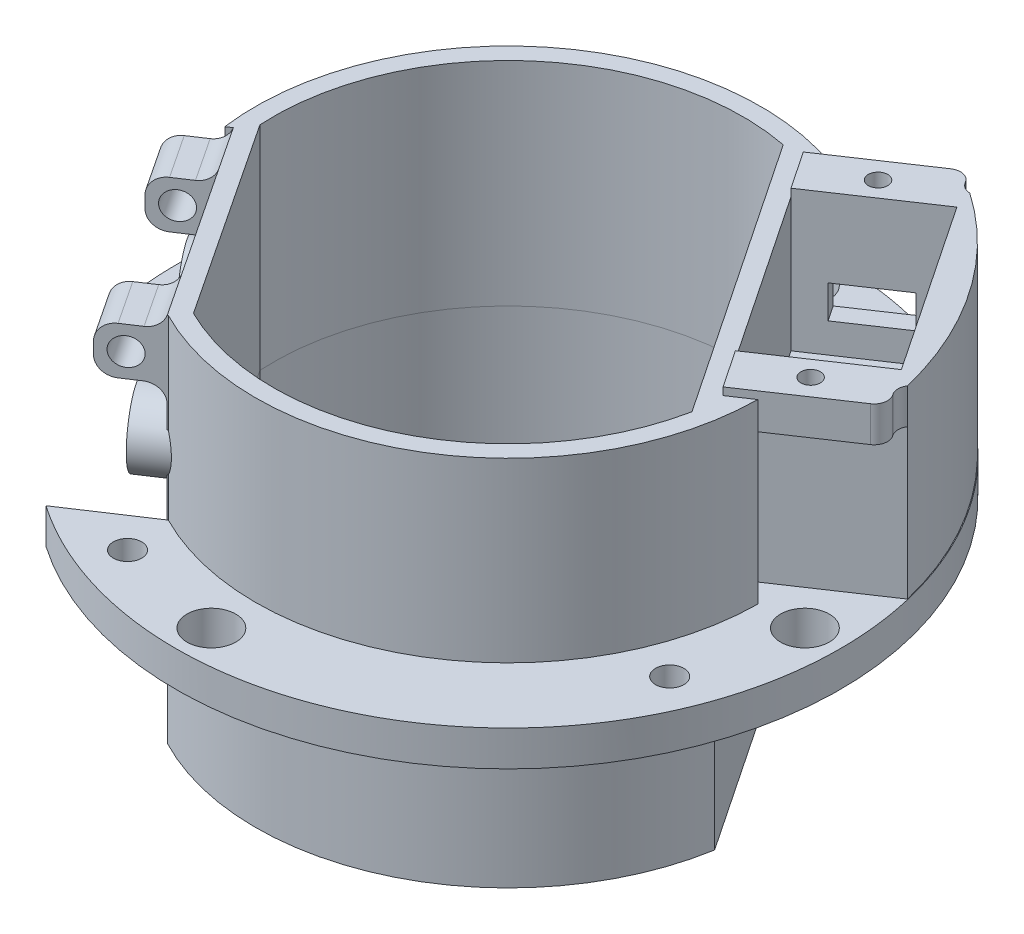
from build123d import *

# Parameters (mm, degrees)
SKETCH1_R           = 37.5
BOSS_EXTRUDE1_DEPTH = 4
BOSS_EXTRUDE2_DEPTH = 20
SKETCH5_R           = 2.75
SKETCH5_R_2         = 1.6
CUT_EXTRUDE2_DEPTH  = 10
BOSS_EXTRUDE3_DEPTH = 13.5
BOSS_EXTRUDE4_DEPTH = 20.85
FILLET2_R           = 1.5
FILLET3_R           = 1.5
SKETCH9_R           = 1.099999999
SKETCH9_R_2         = 1.1
CUT_EXTRUDE3_DEPTH  = 3.5
SKETCH10_W          = 7.15661295
SKETCH10_H          = 3.712399304
CUT_EXTRUDE4_DEPTH  = 2.5
CUT_EXTRUDE5_DEPTH  = 5.5
BOSS_EXTRUDE5_START = -0.8
SKETCH12_R          = 4
BOSS_EXTRUDE5_DEPTH = 4
SKETCH13_R          = 2.1
CUT_EXTRUDE6_DEPTH  = 4
CUT_EXTRUDE7_START  = -10
CUT_EXTRUDE7_DEPTH  = 10
BOSS_EXTRUDE6_DEPTH = 18
SHELL1_T            = -2
SKETCH17_W          = 5.885203378
SKETCH17_H          = 5.337100414
BOSS_EXTRUDE7_DEPTH = 6
SKETCH18_R          = 1.55
CUT_EXTRUDE8_DEPTH  = 47
FILLET4_R           = 2


# Some blends are built 0.0001 mm under size
with BuildPart() as part:
    # Sketch1 → Boss-Extrude1 (new body)
    with BuildSketch(Plane(origin=(0, 0, 0), x_dir=(1, 0, 0), z_dir=(0, 1, 0))):
        with Locations(Location((0, 0, 0), (0, 0, 270))):
            Circle(SKETCH1_R)
    extrude(amount=BOSS_EXTRUDE1_DEPTH)

    # Sketch3 → Boss-Extrude2 (add)
    with BuildSketch(Plane(origin=(0, 4, 0), x_dir=(1, 0, 0), z_dir=(0, 1, 0))):
        with BuildLine():
            Line((9.576757292, 26.842796422), (7.719584901, 25.597712426))
            Line((7.719584901, 25.597712426), (26.151524, -1.895443469))
            Line((26.151524, -1.895443469), (28.498178651, -0.322201176))
            ThreePointArc((28.498178651, -0.322201176), (14.731875513, -24.397168768), (-12.983961499, -25.370588164))
            Line((-12.983961499, -25.370588164), (-13.060506914, -25.421249846))
            Line((-13.060506914, -25.421249846), (-15.809741222, -21.267394822))
            Line((-15.809741222, -21.267394822), (-25.75450861, -6.241712264))
            Line((-25.75450861, -6.241712264), (-27.675272058, -3.339604984))
            Line((-27.675272058, -3.339604984), (-28.255683957, -3.723751348))
            ThreePointArc((-28.255683957, -3.723751348), (-17.91100321, 22.168580559), (9.576757292, 26.842796422))
        make_face()
        with BuildLine():
            Line((5.029746617, 26.018294505), (25.978878936, -5.229517112))
            ThreePointArc((25.978878936, -5.229517112), (11.666379673, -23.793814014), (-11.774565453, -23.740463525))
            Line((-11.774565453, -23.740463525), (-26.453975583, -1.561145685))
            ThreePointArc((-26.453975583, -1.561145685), (-17.461551391, 19.933495002), (5.029746617, 26.018294505))
        make_face(mode=Mode.SUBTRACT)
    extrude(amount=BOSS_EXTRUDE2_DEPTH)

    # Sketch5 → Cut-Extrude2 (cut)
    with BuildSketch(Plane(origin=(0, 4, 0), x_dir=(1, 0, 0), z_dir=(0, 1, 0))):
        with Locations(Location((-33.494924463, 0.000134114, 0), (0, 0, 270))):
            Circle(SKETCH5_R)
        with Locations(Location((-0.000133567, 33.494790806, 0), (0, 0, 270))):
            Circle(SKETCH5_R)
        with Locations(Location((33.494523125, -9e-08, 0), (0, 0, 270))):
            Circle(SKETCH5_R)
        with Locations(Location((-0.000267771, -33.494656782, 0), (0, 0, 270))):
            Circle(SKETCH5_R)
        with Locations(Location((-12.362017583, -30.597067201, 0), (0, 0, 270))):
            Circle(SKETCH5_R_2)
        with Locations(Location((-30.597067201, 12.362017583, 0), (0, 0, 270))):
            Circle(SKETCH5_R_2)
        with Locations(Location((12.362017583, 30.597067201, 0), (0, 0, 270))):
            Circle(SKETCH5_R_2)
        with Locations(Location((30.597067201, -12.362017583, 0), (0, 0, 270))):
            Circle(SKETCH5_R_2)
    extrude(amount=-CUT_EXTRUDE2_DEPTH, mode=Mode.SUBTRACT)

    # Sketch7 → Boss-Extrude3 (add)
    with BuildSketch(Plane(origin=(17.165530655, 0, -11.508101029), x_dir=(-0.5568561661328637, 0, -0.8306089394172258), z_dir=(0.8306089394172257, 0, -0.5568561661328636))):
        Polygon((-11.037009674, 24.85), (-11.037009674, 8.95), (11.862990326, 8.95), (11.862990326, 24.85), (16.962990264, 24.85), (16.962990264, 20.85), (13.962990326, 20.85), (13.962990326, 4), (-13.137009674, 4), (-13.137009674, 20.85), (-16.137009736, 20.85), (-16.137009736, 24.85), align=None)
    extrude(amount=BOSS_EXTRUDE3_DEPTH)

    # Sketch8 → Boss-Extrude4 (add)
    with BuildSketch(Plane(origin=(0, 4, 0), x_dir=(1, 0, 0), z_dir=(0, 1, 0))):
        with BuildLine():
            Line((35.694176179, 8.113941599), (20.603374077, 30.623443857))
            Line((20.603374077, 30.623443857), (21.130699667, 30.976973048))
            ThreePointArc((21.130699667, 30.976973048), (30.844897132, 21.206897721), (36.451861866, 8.621908618))
            Line((36.451861866, 8.621908618), (35.694176179, 8.113941599))
        make_face()
    extrude(amount=BOSS_EXTRUDE4_DEPTH)

    # Fillet2
    # the kernel refuses this fillet: 1.5 mm, written as the material it adds along each edge
    with BuildSketch(Plane(origin=(20.603374077, 20.85, -30.623443857), x_dir=(-0.5568561661328623, 0, -0.8306089394172268), z_dir=(0, 1, 0))) as fillet2_piece_1:
        with BuildLine():
            CenterArc((1.225374885, -1.5), FILLET2_R, 90, 54.777313156)
            Line((0, -0.634866258), (0, 0))
            Line((0, 0), (1.225374885, 0))
        make_face()
    extrude(amount=4)
    with BuildSketch(Plane(origin=(35.694176179, 20.85, -8.113941599), x_dir=(0.5568561661328658, 0, 0.8306089394172244), z_dir=(0, 1, 0))) as fillet2_piece_2:
        with BuildLine():
            CenterArc((1.380035189, 1.5), FILLET2_R, 203.070488273, 66.929511727)
            Line((0, 0.912205071), (0, 0))
            Line((0, 0), (1.380035189, 0))
        make_face()
    extrude(amount=4)
    # the kernel refuses this fillet: 1.5 mm, written as the material it takes off along each edge
    with BuildSketch(Plane(origin=(18.932805613, 28.6, -33.115270624), x_dir=(0.5568561661328623, 0, 0.8306089394172267), z_dir=(0, -1, 0))) as fillet2_2_piece_1:
        with BuildLine():
            CenterArc((FILLET2_R, FILLET2_R), FILLET2_R, 180, 90)
            Line((0, FILLET2_R), (0, 0))
            Line((0, 0), (FILLET2_R, 0))
        make_face()
    extrude(amount=11.5, mode=Mode.SUBTRACT)
    with BuildSketch(Plane(origin=(37.364744712, 17.1, -5.62211473), x_dir=(-0.8306089394172258, 0, 0.5568561661328635), z_dir=(0, 1, 0))) as fillet2_2_piece_2:
        with BuildLine():
            CenterArc((FILLET2_R, -FILLET2_R), FILLET2_R, 90, 90)
            Line((0, -FILLET2_R), (0, 0))
            Line((0, 0), (FILLET2_R, 0))
        make_face()
    extrude(amount=11.5, mode=Mode.SUBTRACT)

    # Fillet3
    fillet3_edges = [part.edges().sort_by_distance(p)[0] for p in [
        (26.151524, 12.425, 1.895443469),
        (24.480955497, 12.425, -0.596383356),
        (9.390153395, 12.425, -23.105885614),
        (7.719584901, 12.425, -25.597712426),
    ]]
    fillet(fillet3_edges, radius=FILLET3_R - 0.0001)  # a hair under: the kernel refuses the full size

    # Sketch9 → Cut-Extrude3 (cut)
    with BuildSketch(Plane(origin=(0, 24.85, 0), x_dir=(1, 0, 0), z_dir=(0, 1, 0))):
        with Locations(Location((14.677272741, 27.071849433, 0), (0, 0, 270))):
            Circle(SKETCH9_R)
        with Locations(Location((30.15787416, 3.980920917, 0), (0, 0, 270))):
            Circle(SKETCH9_R_2)
    extrude(amount=-CUT_EXTRUDE3_DEPTH, mode=Mode.SUBTRACT)

    # Sketch10 → Cut-Extrude4 (cut)
    with BuildSketch(Plane(origin=(-7.77537726, 0, -11.597784585), x_dir=(-0.8306089394172258, 0, 0.5568561661328637), z_dir=(-0.5568561661328636, 0, -0.8306089394172257))):
        with Locations((-27.266200231, 14.15)):
            Rectangle(SKETCH10_W, SKETCH10_H)
    extrude(amount=-CUT_EXTRUDE4_DEPTH, mode=Mode.SUBTRACT)

    # Sketch11 → Cut-Extrude5 (cut)
    with BuildSketch(Plane(origin=(0, 4, 0), x_dir=(1, 0, 0), z_dir=(0, 1, 0))):
        Polygon((-27.675272058, -3.339604984), (-41.210444234, -12.297876153), (-26.59567909, -34.379521015), (-13.060506914, -25.421249846), align=None)
    extrude(amount=-CUT_EXTRUDE5_DEPTH, mode=Mode.SUBTRACT)

    # Sketch12 → Boss-Extrude5 (add)
    with BuildSketch(Plane(origin=(-20.782068468, 0, 13.75463883), x_dir=(0.5519171126658301, 0, 0.8338989751442398), z_dir=(-0.8338989751442399, 0, 0.5519171126658301)).offset(BOSS_EXTRUDE5_START)):
        with Locations(Location((-9.689563073, 10.6000508, 0), (0, 0, 134.427004001))):
            Circle(SKETCH12_R)
        with Locations(Location((10.650436927, 10.6000508, 0), (0, 0, 326.615838194))):
            Circle(SKETCH12_R)
    extrude(amount=BOSS_EXTRUDE5_DEPTH)

    # Sketch13 → Cut-Extrude6 (cut)
    with BuildSketch(Plane(origin=(-23.450545189, 0, 15.520773591), x_dir=(0.5519171126658301, 0, 0.8338989751442397), z_dir=(-0.8338989751442397, 0, 0.5519171126658301))):
        with Locations((-9.689563073, 10.6000508)):
            Circle(SKETCH13_R)
        with Locations((10.650436927, 10.6000508)):
            Circle(SKETCH13_R)
    extrude(amount=-CUT_EXTRUDE6_DEPTH, mode=Mode.SUBTRACT)

    # Sketch14 → Cut-Extrude7 (cut)
    with BuildSketch(Plane(origin=(0, 4, 0), x_dir=(1, 0, 0), z_dir=(0, 1, 0)).offset(CUT_EXTRUDE7_START)):
        with BuildLine():
            Line((25.978878936, -5.229517112), (5.029746617, 26.018294505))
            ThreePointArc((5.029746617, 26.018294505), (-17.461551391, 19.933495002), (-26.453975583, -1.561145685))
            Line((-26.453975583, -1.561145685), (-11.774565453, -23.740463525))
            ThreePointArc((-11.774565453, -23.740463525), (11.666379673, -23.793814014), (25.978878936, -5.229517112))
        make_face()
    extrude(amount=CUT_EXTRUDE7_DEPTH, mode=Mode.SUBTRACT)

    # Sketch17 → Boss-Extrude7 (add)
    with BuildSketch(Plane(origin=(-20.782068468, 0, 13.75463883), x_dir=(0.5519171126658285, 0, 0.8338989751442409), z_dir=(-0.8338989751442409, 0, 0.5519171126658285))):
        with Locations((-9.546961384, 19.990007272)):
            Rectangle(SKETCH17_W, SKETCH17_H)
        with Locations((11.047835238, 19.990007272)):
            Rectangle(SKETCH17_W, SKETCH17_H)
    extrude(amount=BOSS_EXTRUDE7_DEPTH)

    # Sketch18 → Cut-Extrude8 (cut)
    with BuildSketch(Plane(origin=(-6.89320359, 0, -10.415033847), x_dir=(-0.8338989751442407, 0, 0.5519171126658288), z_dir=(-0.5519171126658288, 0, -0.8338989751442407))):
        with Locations((28.269577066, 19.990007272)):
            Circle(SKETCH18_R)
    extrude(amount=-CUT_EXTRUDE8_DEPTH, mode=Mode.SUBTRACT)

    # Fillet4
    # the kernel refuses this fillet: 2 mm, written as the material it adds along each edge
    with BuildSketch(Plane(origin=(-27.675272058, 17.321457065, 3.339604984), x_dir=(0, -1, 0), z_dir=(0.5519171126658285, 0, 0.8338989751442409))) as fillet4_piece_1:
        with BuildLine():
            CenterArc((FILLET4_R, -FILLET4_R), FILLET4_R, 90, 90)
            Line((0, -FILLET4_R), (0, 0))
            Line((0, 0), (FILLET4_R, 0))
        make_face()
    extrude(amount=5.885203378)
    with BuildSketch(Plane(origin=(-24.427127602, 22.658557479, 8.247270049), x_dir=(0, 1, 0), z_dir=(-0.5519171126658285, 0, -0.8338989751442409))) as fillet4_piece_2:
        with BuildLine():
            CenterArc((2, -1.888465527), FILLET4_R, 109.225003758, 70.774996242)
            Line((0, -1.888465527), (0, 0))
            Line((0, 0), (1.341442521, 0))
        make_face()
    extrude(amount=5.885203378)
    with BuildSketch(Plane(origin=(-13.060506914, 17.321457065, 25.421249846), x_dir=(0, -1, 0), z_dir=(-0.5519171126658285, 0, -0.8338989751442409))) as fillet4_piece_3:
        with BuildLine():
            CenterArc((FILLET4_R, FILLET4_R), FILLET4_R, 180, 90)
            Line((0, FILLET4_R), (0, 0))
            Line((0, 0), (FILLET4_R, 0))
        make_face()
    extrude(amount=5.885203378)
    with BuildSketch(Plane(origin=(-16.30865137, 22.658557479, 20.51358478), x_dir=(0, 1, 0), z_dir=(0.5519171126658285, 0, 0.8338989751442409))) as fillet4_piece_4:
        with BuildLine():
            CenterArc((2, 1.888465527), FILLET4_R, 180, 70.774996242)
            Line((0, 1.888465527), (0, 0))
            Line((0, 0), (1.341442521, 0))
        make_face()
    extrude(amount=5.885203378)
    # the kernel refuses this fillet: 2 mm, written as the material it takes off along each edge
    with BuildSketch(Plane(origin=(-35.438251472, 17.321457065, 2.481612784), x_dir=(0.8338989751442409, 0, -0.5519171126658284), z_dir=(0.5519171126658285, 0, 0.8338989751442409)), Plane(origin=(-24.071630784, 22.658557479, 19.655592581), x_dir=(0, -1, 0), z_dir=(0.5519171126658285, 0, 0.8338989751442409))) as fillet4_2_piece_1:
        with BuildLine():
            CenterArc((FILLET4_R, FILLET4_R), FILLET4_R, 180, 90)
            Line((0, FILLET4_R), (0, 0))
            Line((0, 0), (FILLET4_R, 0))
        make_face()
    extrude(amount=15.885203378, mode=Mode.SUBTRACT)
    with BuildSketch(Plane(origin=(-26.67093589, 22.658557479, 15.728267601), x_dir=(0, -1, 0), z_dir=(-0.5519171126658285, 0, -0.8338989751442409)), Plane(origin=(-15.304315202, 17.321457065, 32.902247397), x_dir=(0.8338989751442408, 0, -0.5519171126658284), z_dir=(-0.5519171126658285, 0, -0.8338989751442409))) as fillet4_2_piece_2:
        with BuildLine():
            CenterArc((FILLET4_R, -FILLET4_R), FILLET4_R, 90, 90)
            Line((0, -FILLET4_R), (0, 0))
            Line((0, 0), (FILLET4_R, 0))
        make_face()
    extrude(amount=15.885203378, mode=Mode.SUBTRACT)


with BuildPart() as body_2:
    # Sketch15 → Boss-Extrude6 (new body)
    with BuildSketch(Plane.XZ):
        with BuildLine():
            Line((6.236979508, -27.809172707), (28.094081803, 4.792970649))
            ThreePointArc((28.094081803, 4.792970649), (12.680581728, 25.523574339), (-13.151117468, 25.284345144))
            Line((-13.151117468, 25.284345144), (-28.413019468, 2.224932517))
            ThreePointArc((-28.413019468, 2.224932517), (-18.666977694, -21.535875737), (6.236979508, -27.809172707))
        make_face()
    extrude(amount=BOSS_EXTRUDE6_DEPTH)

    # Shell1
    shell1_openings = [body_2.faces().sort_by_distance(p)[0] for p in [
        (-1.194735411, 0, 0.806510977),
    ]]
    offset(amount=SHELL1_T, openings=shell1_openings, kind=Kind.INTERSECTION)


solid = Compound([part.part, body_2.part])
